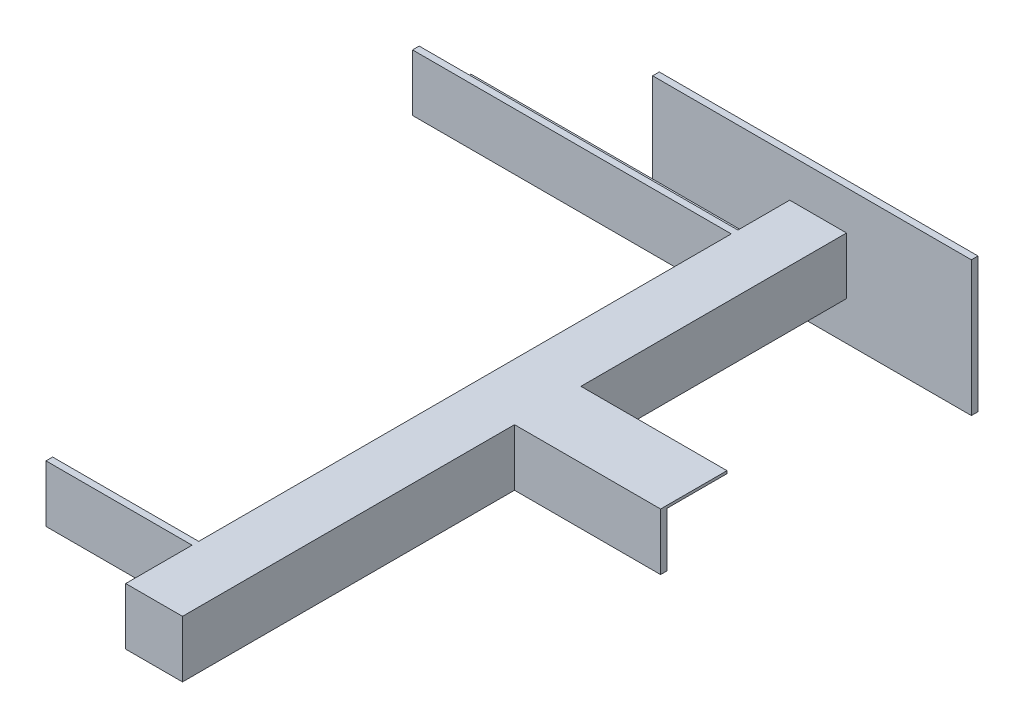
from build123d import *

# Parameters (mm, degrees)
SKETCH1_W             = 240
SKETCH1_H             = 101.6
BOSS_EXTRUDE1_DEPTH   = 5
SKETCH2_W             = 42.790852113
SKETCH2_H             = 42.790852114
BOSS_EXTRUDE2_DEPTH   = 500
BOSS_EXTRUDE3_DEPTH   = 110
BOSS_EXTRUDE4_DEPTH   = 110
BOSS_EXTRUDE4_2_DEPTH = 110
BOSS_EXTRUDE5_START   = 110
BOSS_EXTRUDE5_DEPTH   = 130


# Read off the part's stored shape, not the designer's step: Boss-Extrude3
with BuildPart() as part:
    # Sketch1 → Boss-Extrude1 (new body)
    with BuildSketch(Plane.XY.offset(40212.600196068)):
        with Locations((-22830.561141865, -1672.538517707)):
            Rectangle(SKETCH1_W, SKETCH1_H)
    extrude(amount=BOSS_EXTRUDE1_DEPTH)


with BuildPart() as body_2:
    # Sketch2 → Boss-Extrude2 (new body)
    with BuildSketch(Plane.XY.offset(40217.600196068)):
        with Locations((-22825.956567922, -1672.642858756)):
            Rectangle(SKETCH2_W, SKETCH2_H)
    extrude(amount=BOSS_EXTRUDE2_DEPTH)


with BuildPart() as body_3:
    # Boss-Extrude3 outline → Boss-Extrude3 (new body)
    with BuildSketch(Plane(origin=(-22804.561141865, 0, 0), x_dir=(0, 0, -1), z_dir=(1, 0, 0))):
        Polygon((-40467.600196068, -1694.038284813), (-40462.600196068, -1694.038284813), (-40462.600196068, -1653.231371608), (-40417.600196068, -1653.231371608), (-40417.600196068, -1651.247432699), (-40467.600196068, -1651.247432699), align=None)
    extrude(amount=BOSS_EXTRUDE3_DEPTH)


with BuildPart() as body_4:
    # Sketch4 → Boss-Extrude4 (new body)
    with BuildSketch(Plane.ZY.offset(22847.351993978)):
        Polygon((40667.600196068, -1651.247432699), (40662.600196068, -1651.247432699), (40662.600196068, -1689.038284813), (40624.809343955, -1689.038284813), (40624.809343955, -1694.038284813), (40667.600196068, -1694.038284813), align=None)
    extrude(amount=BOSS_EXTRUDE4_DEPTH)


with BuildPart() as body_5:
    # Sketch4 → Boss-Extrude4 2 (new body)
    with BuildSketch(Plane.ZY.offset(22847.351993978)):
        Polygon((40261.600196068, -1651.247432699), (40256.600196068, -1651.247432699), (40256.600196068, -1689.038284813), (40217.600196068, -1689.038284813), (40217.600196068, -1694.038284813), (40261.600196068, -1694.038284813), align=None)
    extrude(amount=BOSS_EXTRUDE4_2_DEPTH)

    # Sketch4<3> → Boss-Extrude5 (add)
    with BuildSketch(Plane.ZY.offset(22847.351993978).offset(BOSS_EXTRUDE5_START)):
        Polygon((40261.600196068, -1694.038284813), (40261.600196068, -1651.247432699), (40256.600196068, -1651.247432699), (40256.600196068, -1689.038284813), (40217.600196068, -1689.038284813), (40217.600196068, -1694.038284813), align=None)
    extrude(amount=BOSS_EXTRUDE5_DEPTH)


with BuildPart() as body_2_1:
    add(body_2.part)

    # Combine1: union body 3, body 4, body 5, part
    add(body_3.part)
    add(body_4.part)
    add(body_5.part)
    add(part.part)


solid = body_2_1.part
